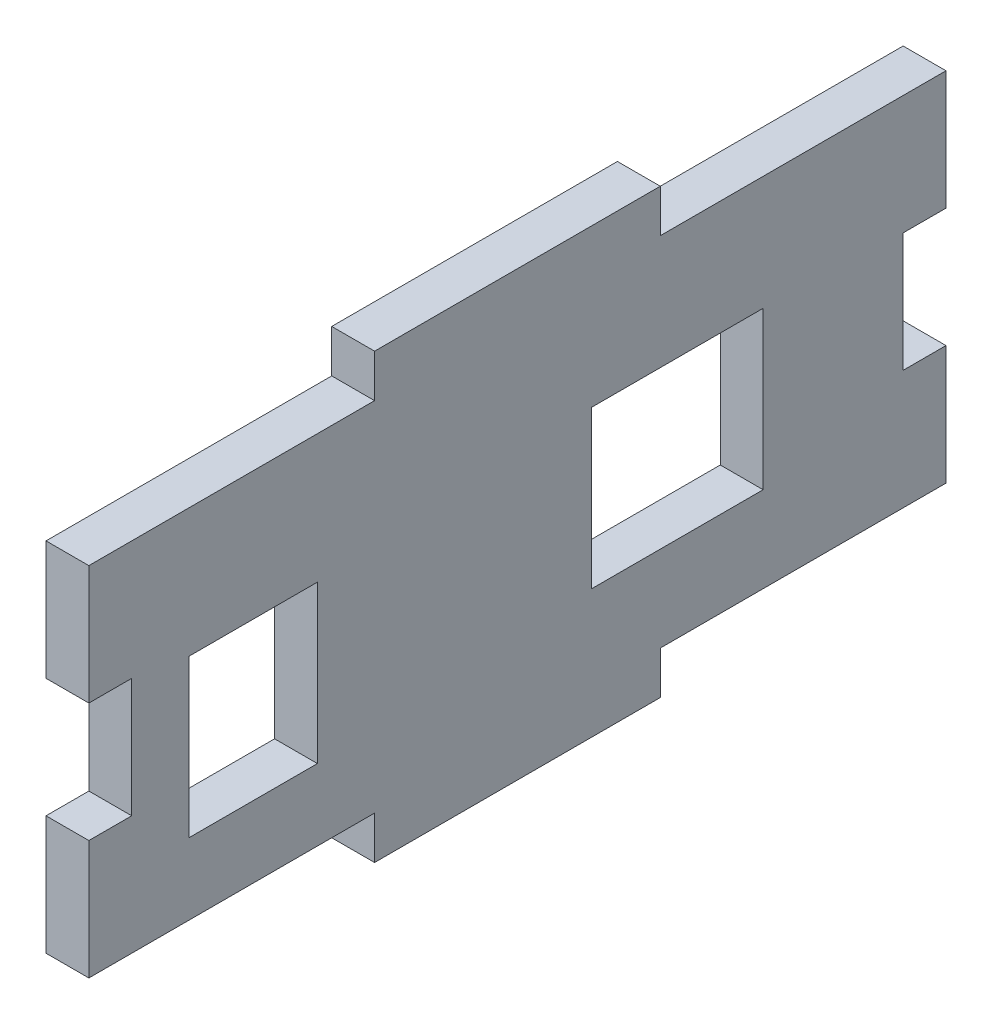
from build123d import *

# Parameters (mm, degrees)
SIDES_W              = 12
SIDES_H              = 11
SIDES_W_2            = 9
SIDES_EXTRUDED_DEPTH = 3


with BuildPart() as part:
    # Sides → Sides Extruded (new body)
    with BuildSketch(Plane(origin=(0, 0, 0), x_dir=(0, 0, -1), z_dir=(1, 0, 0))):
        Polygon((0, 16.66666666), (0, 25), (20, 25), (20, 28), (40, 28), (40, 25), (60, 25), (60, 16.67), (57, 16.67), (57, 8.34), (60, 8.34), (60, 0), (40, 0), (40, -3), (20, -3), (20, 0), (0, 0), (0, 8.33333333), (3, 8.33333333), (3, 16.66666666), align=None)
        with Locations((41.2, 11.5)):
            Rectangle(SIDES_W, SIDES_H, mode=Mode.SUBTRACT)
        with Locations((11.5, 10.5)):
            Rectangle(SIDES_W_2, SIDES_H, mode=Mode.SUBTRACT)
    extrude(amount=SIDES_EXTRUDED_DEPTH)


solid = part.part
